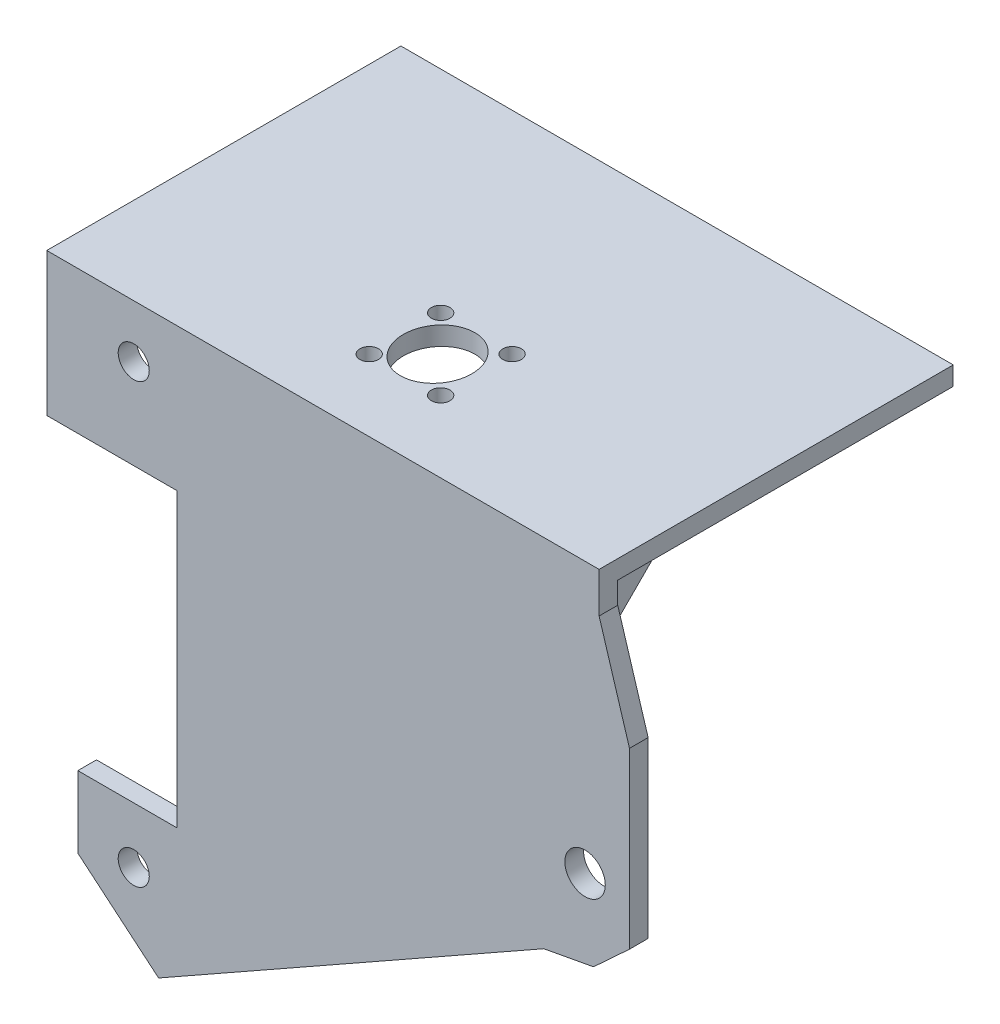
from build123d import *

# Parameters (mm, degrees)
BOSS_EXTRUDE1_DEPTH = 3
SKETCH2_W           = 88.9
SKETCH2_H           = 57
SKETCH2_R           = 1.5
SKETCH2_RX          = 6
SKETCH2_RY          = 5.5
BOSS_EXTRUDE2_DEPTH = 3
BOSS_EXTRUDE3_DEPTH = 84.5
SKETCH4_W           = 75
SKETCH4_H           = 11.5
CUT_EXTRUDE2_DEPTH  = 84.5
SKETCH6_R           = 2.5
SKETCH6_R_2         = 3.25
CUT_EXTRUDE3_DEPTH  = 84.5


with BuildPart() as part:
    # Sketch1 → Boss-Extrude1 (new body)
    with BuildSketch(Plane.XY):
        Polygon((0, 0), (88.9, 0), (88.9, -3.5), (93.791690903, -19.5), (93.791690903, -47.5), (88, -52.847670598), (80, -54.330382958), (18, -89.408295205), (5, -78.5), (5, -67), (21, -67), (21, -20), (0, -20), align=None)
    extrude(amount=BOSS_EXTRUDE1_DEPTH)

    # Sketch2 → Boss-Extrude2 (add)
    with BuildSketch(Plane(origin=(0, 0, 0), x_dir=(1, 0, 0), z_dir=(0, 1, 0))):
        with Locations((44.45, 25.5)):
            Rectangle(SKETCH2_W, SKETCH2_H)
        with Locations((40.3978, 8.5)):
            Circle(SKETCH2_R, mode=Mode.SUBTRACT)
        with Locations((40.3978, 20)):
            Circle(SKETCH2_R, mode=Mode.SUBTRACT)
        with Locations((51.8978, 8.5)):
            Circle(SKETCH2_R, mode=Mode.SUBTRACT)
        with Locations((51.8978, 20)):
            Circle(SKETCH2_R, mode=Mode.SUBTRACT)
        with Locations(Location((45.8978, 14), (0, 0, -90))):
            Ellipse(SKETCH2_RX, SKETCH2_RY, mode=Mode.SUBTRACT)
    extrude(amount=BOSS_EXTRUDE2_DEPTH)

    # Sketch3 → Boss-Extrude3 (add)
    with BuildSketch(Plane(origin=(85.9, 0, 0), x_dir=(0, 0, -1), z_dir=(1, 0, 0))):
        Polygon((11.5, 0), (0, 0), (0, -11.5), align=None)
    extrude(amount=-BOSS_EXTRUDE3_DEPTH)

    # Sketch4 → Cut-Extrude2 (cut)
    with BuildSketch(Plane(origin=(0, 0, 0), x_dir=(-1, 0, 0), z_dir=(0, 0, -1))):
        with Locations((-43.9, -5.75)):
            Rectangle(SKETCH4_W, SKETCH4_H)
    extrude(amount=CUT_EXTRUDE2_DEPTH, mode=Mode.SUBTRACT)

    # Sketch6 → Cut-Extrude3 (cut)
    with BuildSketch(Plane.XY.offset(3)):
        with Locations((14, -76)):
            Circle(SKETCH6_R)
        with Locations((86.644, -40.5)):
            Circle(SKETCH6_R_2)
        with Locations((14, -5.5)):
            Circle(SKETCH6_R)
    extrude(amount=-CUT_EXTRUDE3_DEPTH, mode=Mode.SUBTRACT)


solid = part.part
